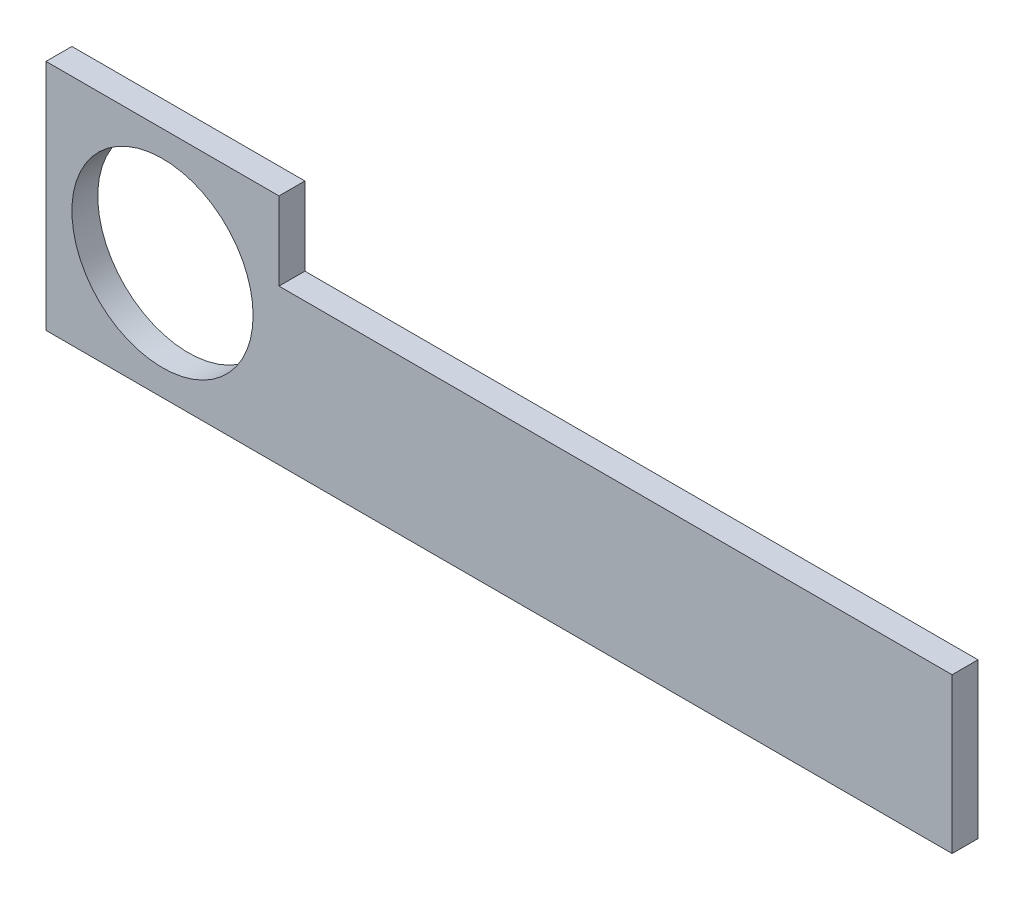
from build123d import *

# Parameters (mm, degrees)
BOSS_EXTRUDE1_DEPTH = 10
SKETCH2_R           = 35
CUT_EXTRUDE1_DEPTH  = 502.570292728


with BuildPart() as part:
    # Sketch1 → Boss-Extrude1 (new body)
    with BuildSketch(Plane.XY):
        Polygon((-20.300605602, -278.331336778), (-280.300605602, -278.331336778), (-280.300605602, -248.157093728), (-370.300605602, -248.157093728), (-370.300605602, -278.331336778), (-370.300605602, -338.157093728), (-20.300605602, -338.157093728), align=None)
    extrude(amount=BOSS_EXTRUDE1_DEPTH)

    # Sketch2 → Cut-Extrude1 (cut, through all)
    with BuildSketch(Plane.XY.offset(10)):
        with Locations((-325.300605602, -293.157093728)):
            Circle(SKETCH2_R)
    extrude(amount=-CUT_EXTRUDE1_DEPTH, mode=Mode.SUBTRACT)


solid = part.part
